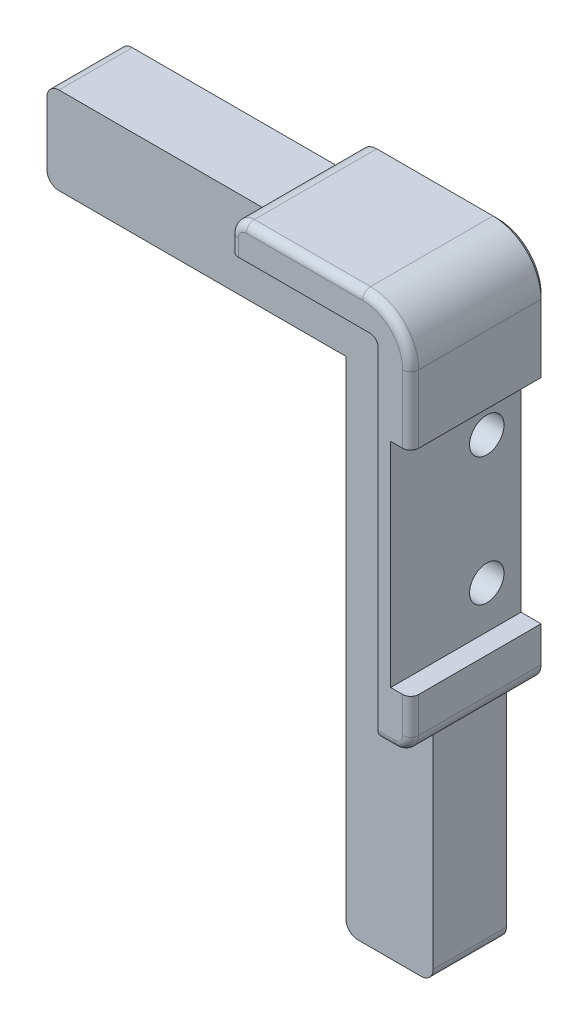
from build123d import *

# Parameters (mm, degrees)
BODY_AND_TONGUES_DEPTH     = 4.875
RIM_DEPTH                  = 8.435
BRACKET_SEAT_SKETCH_W      = 3.5
BRACKET_SEAT_SKETCH_H      = 26.6
BRACKET_SEAT_DEPTH         = 9.435
SCREW_PILOTS_SKETCH_R      = 2.15
SCREW_PILOTS_DEPTH         = 4.5
BUMPER_CORNER_R            = 6
INSIDE_CORNER_OF_THE_RIM_R = 1
RIM_ENDS_R                 = 2
TONGUE_LEAD_IN_R           = 1.5
RIM_TOP_EDGE_R             = 1
BED_FACE_CHAMFER_SIZE      = 0.6


with BuildPart() as part:
    # body and tongues sketch → body and tongues (new, symmetric)
    with BuildSketch(Plane.XY.offset(20.375)):
        Polygon((4.42, 7.07), (-18.08, 7.07), (-18.08, 2.75), (-48.08, 2.75), (-48.08, -8.13), (-10.78, -8.13), (-10.78, -70.43), (0.1, -70.43), (0.1, -40.43), (4.42, -40.43), align=None)
    extrude(amount=BODY_AND_TONGUES_DEPTH, both=True)

    # rim sketch → rim (add, symmetric)
    with BuildSketch(Plane.XY.offset(23.935)):
        Polygon((4.42, 7.07), (-18.08, 7.07), (-18.08, 3), (0.35, 3), (0.35, -40.43), (4.42, -40.43), align=None)
    extrude(amount=RIM_DEPTH, both=True)

    # bracket seat sketch → bracket seat (cut, symmetric)
    with BuildSketch(Plane.XY.offset(23.935)):
        with Locations((3.67, -20.7)):
            Rectangle(BRACKET_SEAT_SKETCH_W, BRACKET_SEAT_SKETCH_H)
    extrude(amount=BRACKET_SEAT_DEPTH, both=True, mode=Mode.SUBTRACT)

    # screw pilots sketch → screw pilots (cut, symmetric)
    with BuildSketch(Plane(origin=(-1.58, 0, 0), x_dir=(0, 0, -1), z_dir=(1, 0, 0))):
        with Locations((-20.375, -28.7)):
            Circle(SCREW_PILOTS_SKETCH_R)
        with Locations((-20.375, -12.7)):
            Circle(SCREW_PILOTS_SKETCH_R)
    extrude(amount=SCREW_PILOTS_DEPTH, both=True, mode=Mode.SUBTRACT)

    # bumper corner
    bumper_corner_edges = [part.edges().sort_by_distance(p)[0] for p in [
        (4.42, 7.07, 23.935),
    ]]
    fillet(bumper_corner_edges, radius=BUMPER_CORNER_R)

    # inside corner of the rim
    inside_corner_of_the_rim_edges = [part.edges().sort_by_distance(p)[0] for p in [
        (0.35, 3, 28.81),
    ]]
    fillet(inside_corner_of_the_rim_edges, radius=INSIDE_CORNER_OF_THE_RIM_R)

    # rim ends
    rim_ends_edges = [part.edges().sort_by_distance(p)[0] for p in [
        (-18.08, 7.07, 23.935),
        (4.42, -40.43, 23.935),
    ]]
    fillet(rim_ends_edges, radius=RIM_ENDS_R)

    # tongue lead-in
    tongue_lead_in_edges = [part.edges().sort_by_distance(p)[0] for p in [
        (-48.08, -8.13, 20.375),
        (-48.08, 2.75, 20.375),
        (-10.78, -70.43, 20.375),
        (0.1, -70.43, 20.375),
    ]]
    fillet(tongue_lead_in_edges, radius=TONGUE_LEAD_IN_R)

    # rim top edge
    rim_top_edge_edges = [part.edges().sort_by_distance(p)[0] for p in [
        (4.42, -36.215, 32.37),
        (2.662640687, 5.312640687, 32.37),
        (-18.08, 4.035, 32.37),
        (-17.494213562, 6.484213562, 32.37),
        (1.385, -40.43, 32.37),
        (3.834213562, -39.844213562, 32.37),
        (-8.83, 7.07, 32.37),
    ]]
    fillet(rim_top_edge_edges, radius=RIM_TOP_EDGE_R)

    # bed face chamfer
    bed_face_chamfer_edges = [part.edges().sort_by_distance(p)[0] for p in [
        (-10.78, -38.53, 15.5),
        (-10.340660172, -69.990660172, 15.5),
        (-5.34, -70.43, 15.5),
        (-0.339339828, -69.990660172, 15.5),
        (0.1, -54.68, 15.5),
        (1.26, -40.43, 15.5),
        (3.834213562, -39.844213562, 15.5),
        (4.42, -3.165, 15.5),
        (3.17, -34, 15.5),
        (1.92, -20.7, 15.5),
        (3.17, -7.4, 15.5),
        (2.662640687, 5.312640687, 15.5),
        (-8.83, 7.07, 15.5),
        (-17.494213562, 6.484213562, 15.5),
        (-18.08, 3.91, 15.5),
        (-32.33, 2.75, 15.5),
        (-47.640660172, 2.310660172, 15.5),
        (-48.08, -2.69, 15.5),
        (-47.640660172, -7.690660172, 15.5),
        (-28.68, -8.13, 15.5),
    ]]
    chamfer(bed_face_chamfer_edges, length=BED_FACE_CHAMFER_SIZE)


solid = part.part
